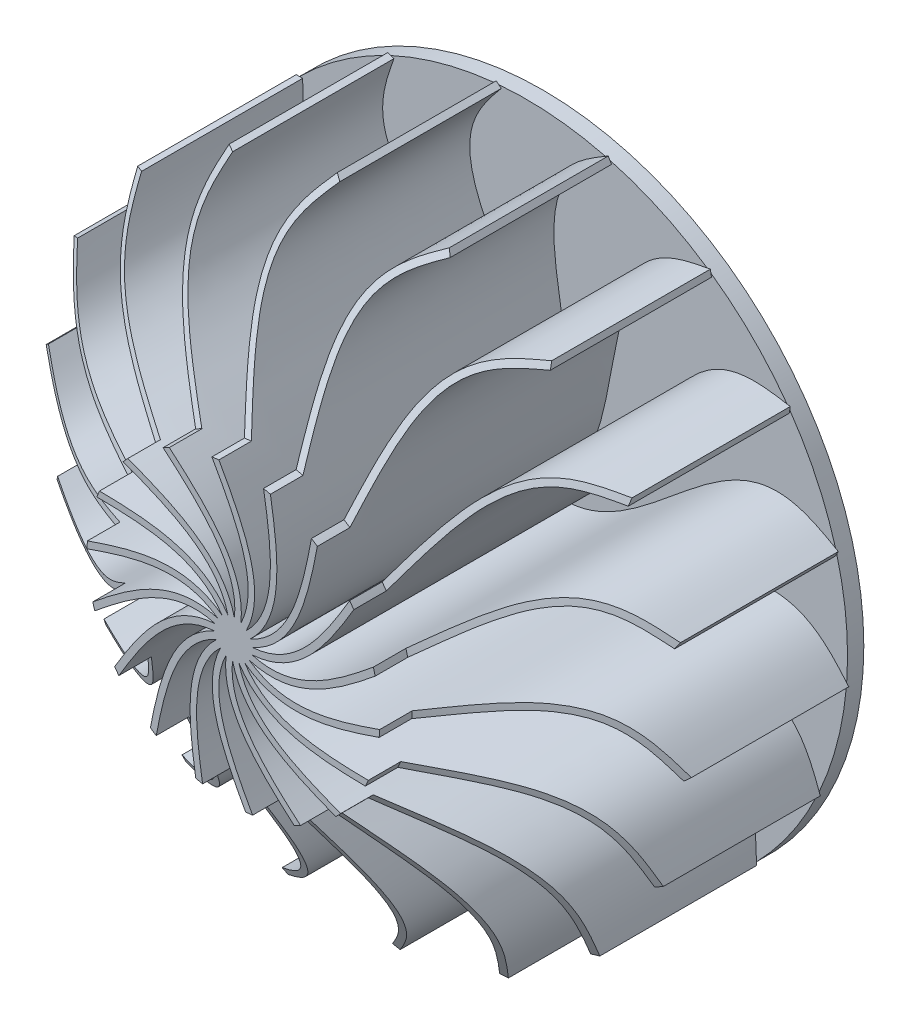
from build123d import *

# Parameters (mm, degrees)
SKETCH1_R           = 197.5
BOSS_EXTRUDE1_DEPTH = 10
EXTRUDE_THIN1_DEPTH = 180
CIRPATTERN1_COUNT   = 18
SKETCH5_R           = 10
CUT_EXTRUDE1_DEPTH  = 5


# Read off the part's stored shape, not the designer's step: Extrude-Thin1
with BuildPart() as part:
    # Sketch1 → Boss-Extrude1 (new body)
    with BuildSketch(Plane.XY):
        Circle(SKETCH1_R)
    extrude(amount=BOSS_EXTRUDE1_DEPTH)

    # Extrude-Thin1 outline → Extrude-Thin1 (add)
    with BuildSketch(Plane.XY.offset(10)):
        with BuildLine():
            Line((1.999745409, 0.031910831), (-1.999745409, -0.031910831))
            add(Edge.make_bspline(
                [(-1.999745409, -0.031910831), (-1.892369554, -6.760797689), (-0.666309176, -12.727486134), (3.504914441, -23.351468413), (6.446055914, -28.003697648), (13.493589594, -36.236996265), (17.598019791, -39.821443421), (26.516986695, -46.215803754), (31.332918377, -49.026899753), (41.31388564, -54.132068749), (46.479474231, -56.425957082), (56.854421661, -60.706732669), (62.063863825, -62.693436731), (72.269212453, -66.531407622), (77.265096217, -68.382610414), (86.834175509, -72.086548814), (91.407304034, -73.939287484), (99.971318083, -77.749377435), (103.962045016, -79.706722071), (111.254451515, -83.794895618), (114.555862448, -85.925517253), (120.422118418, -90.397214245), (122.986965555, -92.737715521), (127.397993257, -97.645807119), (129.244997512, -100.213253865), (132.292326479, -105.586709784), (133.493077891, -108.393702837), (135.348890298, -114.239959803), (136.003306479, -117.279625258), (136.900285239, -123.539597194), (137.142422327, -126.759458574), (137.401908833, -133.284794565), (137.419126217, -136.589775714), (137.447838973, -139.876583843)],
                knots=[0, 0, 0, 0, 0.0625, 0.0625, 0.125, 0.125, 0.1875, 0.1875, 0.25, 0.25, 0.3125, 0.3125, 0.375, 0.375, 0.4375, 0.4375, 0.5, 0.5, 0.5625, 0.5625, 0.625, 0.625, 0.6875, 0.6875, 0.75, 0.75, 0.8125, 0.8125, 0.875, 0.875, 0.9375, 0.9375, 1, 1, 1, 1], degree=3))
            Line((137.447838973, -139.876583843), (141.447686355, -139.841642149))
            add(Edge.make_bspline(
                [(1.999745409, 0.031910831), (2.0498663, -3.108998371), (2.359764013, -6.046233649), (3.429045817, -11.565232691), (4.188372295, -14.147220194), (6.096837245, -19.008023563), (7.246129243, -21.287023195), (9.884235485, -25.587375949), (11.37323212, -27.608702934), (16.279322211, -33.340254793), (20.13593864, -36.719185762), (28.640391571, -42.816364624), (33.2868331, -45.533429693), (43.003001166, -50.503156441), (48.072174693, -52.756002785), (58.313044584, -56.981457044), (63.484657622, -58.954248151), (73.664458514, -62.782611191), (78.672669067, -64.638247161), (88.314405407, -68.37030919), (92.947998198, -70.24673219), (101.682483517, -74.132664014), (105.783534637, -76.142179486), (113.345012571, -80.38119634), (116.805708019, -82.610904998), (123.022106586, -87.349506743), (125.777807605, -89.858973909), (130.557273289, -95.177021527), (132.580214264, -97.985745553), (135.915969985, -103.867793902), (137.228358031, -106.940134344), (139.238657775, -113.273063706), (139.937214288, -116.533251083), (140.885495011, -123.151256973), (141.135644713, -126.509520588), (141.4023686, -133.216855792), (141.419074818, -136.566420844), (141.447686355, -139.841642149)],
                knots=[0, 0, 0, 0, 0.03125, 0.03125, 0.0625, 0.0625, 0.09375, 0.09375, 0.125, 0.125, 0.1875, 0.1875, 0.25, 0.25, 0.3125, 0.3125, 0.375, 0.375, 0.4375, 0.4375, 0.5, 0.5, 0.5625, 0.5625, 0.625, 0.625, 0.6875, 0.6875, 0.75, 0.75, 0.8125, 0.8125, 0.875, 0.875, 0.9375, 0.9375, 1, 1, 1, 1], degree=3))
        make_face()
    extrude_thin1 = extrude(amount=EXTRUDE_THIN1_DEPTH)

    # CirPattern1: Extrude-Thin1 ×18 about axis
    cirpattern1_axis = Axis((0, 0, 10), (0, 0, 1))
    for i in range(1, CIRPATTERN1_COUNT):
        add(extrude_thin1.rotate(cirpattern1_axis, i * 360 / CIRPATTERN1_COUNT))

    # Sketch4 → Cut-Revolve4 (revolve, cut)
    with BuildSketch(Plane(origin=(0, 0, 0), x_dir=(0, 0, -1), z_dir=(1, 0, 0))):
        Polygon((-100.392626155, 211.419736156), (-219.415137242, 211.419736156), (-219.415137242, 1.419736156), (-190, 1.419736156), (-190, 91.419736156), (-170, 91.419736156), align=None)
    revolve(axis=Axis((0, 1.419736156, 219.415137242), (0, 0, -1)), mode=Mode.SUBTRACT)

    # Sketch5 → Cut-Extrude1 (cut)
    with BuildSketch(Plane(origin=(0, 0, 0), x_dir=(-1, 0, 0), z_dir=(0, 0, -1))):
        Circle(SKETCH5_R)
    extrude(amount=-CUT_EXTRUDE1_DEPTH, mode=Mode.SUBTRACT)


solid = part.part
